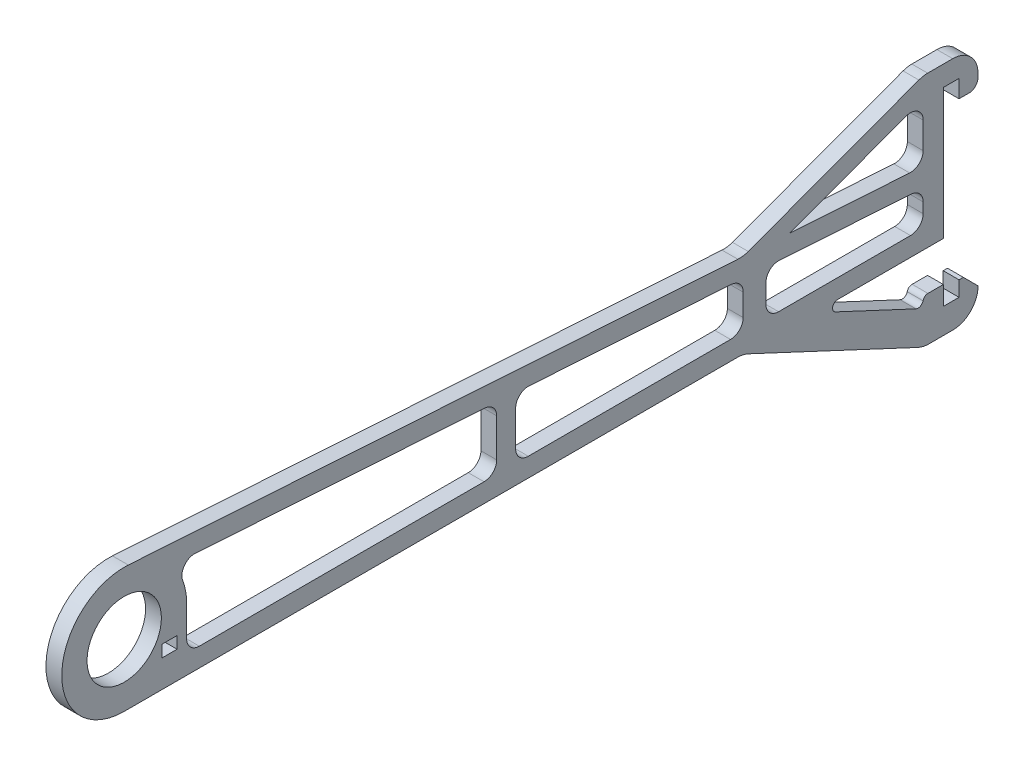
from build123d import *

# Parameters (mm, degrees)
SKETCH1_W           = 1.5113
SKETCH1_H           = 1.1938
SKETCH1_R           = 3.7338
BOSS_EXTRUDE1_DEPTH = 1.5875
FILLET1_R           = 2.54
FILLET2_R           = 1.27
FILLET3_R           = 0.508
FILLET4_R           = 0.508


with BuildPart() as part:
    # Sketch1 → Boss-Extrude1 (new body)
    with BuildSketch(Plane(origin=(0, 0, 0), x_dir=(0, 0, -1), z_dir=(1, 0, 0))):
        with BuildLine():
            Line((62.185099246, 2.211808127), (0.410288477, 6.260369782))
            ThreePointArc((0.410288477, 6.260369782), (-6.270441547, 0.205254114), (0, -6.2738))
            Line((0, -6.2738), (62.185099246, -6.2738))
            Line((62.185099246, -6.2738), (80.264, -14.721036366))
            Line((80.264, -14.721036366), (83.2358, -14.721036366))
            ThreePointArc((83.2358, -14.721036366), (85.031851224, -13.97708759), (85.7758, -12.181036366))
            Line((85.7758, -12.181036366), (85.7758, -12.130236366))
            Line((85.7758, -12.130236366), (84.3026, -10.657036366))
            Line((84.3026, -10.657036366), (83.8708, -10.657036366))
            Line((83.8708, -10.657036366), (83.8708, -12.181036366))
            Line((83.8708, -12.181036366), (82.296, -12.181036366))
            Line((82.296, -12.181036366), (82.296, -10.276036366))
            Line((82.296, -10.276036366), (80.264, -10.276036366))
            Line((80.264, -10.276036366), (80.264, -11.356734872))
            Line((80.264, -11.356734872), (69.385427281, -6.2738))
            Line((69.385427281, -6.2738), (82.296, -6.2738))
            Line((82.296, -6.2738), (82.296, 6.868963634))
            Line((82.296, 6.868963634), (83.8708, 6.868963634))
            Line((83.8708, 6.868963634), (83.8708, 5.090963634))
            Line((83.8708, 5.090963634), (84.8868, 5.090963634))
            ThreePointArc((84.8868, 5.090963634), (85.515417928, 5.351345706), (85.7758, 5.979963634))
            Line((85.7758, 5.979963634), (85.7758, 6.360963634))
            ThreePointArc((85.7758, 6.360963634), (85.031851224, 8.157014859), (83.2358, 8.900963634))
            Line((83.2358, 8.900963634), (80.264, 8.900963634))
            Line((80.264, 8.900963634), (62.185099246, 2.211808127))
        make_face()
        with BuildLine():
            Line((37.420099246, -4.3688), (6.2738, -4.3688))
            Line((6.2738, -4.3688), (6.2738, 0))
            ThreePointArc((6.2738, 0), (5.888187094, 2.165599038), (4.778751005, 4.064985273))
            Line((4.778751005, 4.064985273), (37.420099246, 1.925755558))
            Line((37.420099246, 1.925755558), (37.420099246, -4.3688))
        make_face(mode=Mode.SUBTRACT)
        Polygon((62.185099246, -4.3688), (39.325099246, -4.3688), (39.325099246, 1.800906775), (62.185099246, 0.302721378), align=None, mode=Mode.SUBTRACT)
        Polygon((80.264, -4.3688), (64.471099246, -4.3688), (64.471099246, 0.152902838), (80.264, -0.882123115), align=None, mode=Mode.SUBTRACT)
        Polygon((80.264, 1.026963634), (66.848818814, 1.906159984), (80.264, 6.869748995), align=None, mode=Mode.SUBTRACT)
        with Locations((4.55295, -2.921)):
            Rectangle(SKETCH1_W, SKETCH1_H, mode=Mode.SUBTRACT)
        Circle(SKETCH1_R, mode=Mode.SUBTRACT)
    extrude(amount=BOSS_EXTRUDE1_DEPTH)

    # Fillet1
    fillet1_edges = [part.edges().sort_by_distance(p)[0] for p in [
        (0.79375, 2.211808127, -62.185099246),
        (0.79375, 8.900963634, -80.264),
        (0.79375, -6.2738, -62.185099246),
        (0.79375, -14.721036366, -80.264),
    ]]
    fillet(fillet1_edges, radius=FILLET1_R)

    # Fillet2
    fillet2_edges = [part.edges().sort_by_distance(p)[0] for p in [
        (0.79375, 4.064985273, -4.778751005),
        (0.79375, -4.3688, -6.2738),
        (0.79375, -4.3688, -37.420099246),
        (0.79375, 1.925755558, -37.420099246),
        (0.79375, 0.302721378, -62.185099246),
        (0.79375, -4.3688, -62.185099246),
        (0.79375, -4.3688, -39.325099246),
        (0.79375, 1.800906775, -39.325099246),
        (0.79375, 0.152902838, -64.471099246),
        (0.79375, -4.3688, -64.471099246),
        (0.79375, 1.026963634, -80.264),
        (0.79375, 6.869748995, -80.264),
        (0.79375, -0.882123115, -80.264),
        (0.79375, -4.3688, -80.264),
    ]]
    fillet(fillet2_edges, radius=FILLET2_R)

    # Fillet3
    fillet3_edges = [part.edges().sort_by_distance(p)[0] for p in [
        (0.79375, -6.2738, -69.385427281),
        (0.79375, -11.356734872, -80.264),
    ]]
    fillet(fillet3_edges, radius=FILLET3_R)

    # Fillet4
    fillet4_edges = [part.edges().sort_by_distance(p)[0] for p in [
        (0.79375, -10.276036366, -80.264),
    ]]
    fillet(fillet4_edges, radius=FILLET4_R)


solid = part.part
